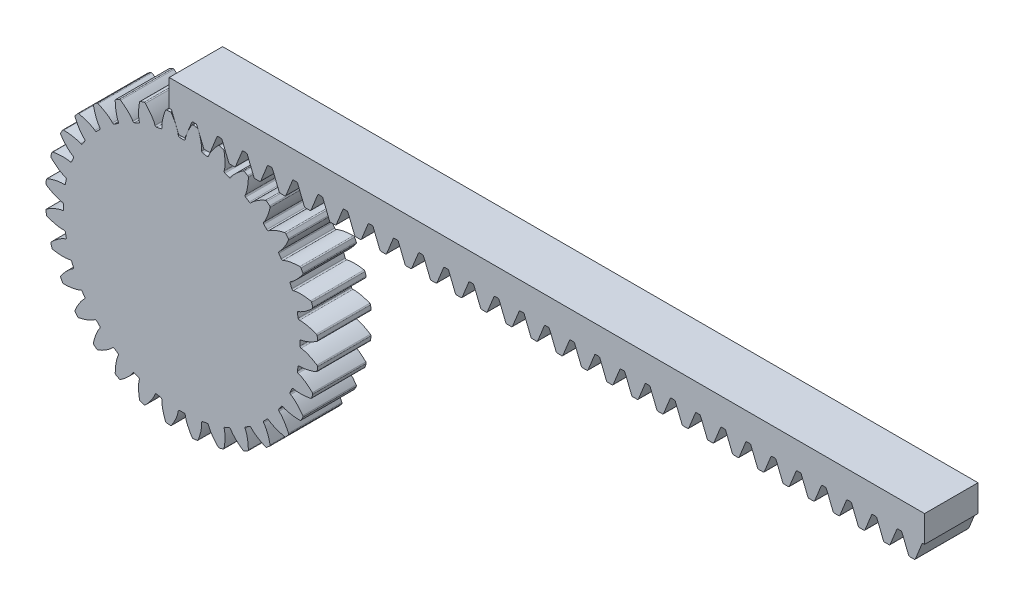
from build123d import *

# Parameters (mm, degrees)
SKETCH1_R                = 51
BOSS_EXTRUDE1_DEPTH      = 20
CUT_EXTRUDE3_DEPTH       = 75.846509605
FILLET1_R                = 0.5
CIRPATTERN1_COUNT        = 32
FILLET1_OF_CIRPATTERN1_R = 0.5
BOSS_EXTRUDE2_DEPTH      = 20
FILLET2_R                = 0.5
LPATTERN7_DEPTH          = 20


# Read off the part's stored shape, not the designer's step: LPattern7
with BuildPart() as part:
    # Sketch1 → Boss-Extrude1 (new body)
    with BuildSketch(Plane.XY):
        Circle(SKETCH1_R)
    extrude(amount=BOSS_EXTRUDE1_DEPTH)

    # Sketch3 → Cut-Extrude3 (cut, through all)
    with BuildSketch(Plane.XY):
        with BuildLine():
            add(Edge.make_bspline(
                [(1.29203821, 44.486066215), (1.302814451, 44.668832694), (1.366057296, 45.076437929), (1.534105828, 45.789290586), (1.827270897, 46.705234433), (2.128888857, 47.445621669), (2.32719165, 47.88141557), (2.355248368, 47.942181898)],
                knots=[0, 0, 0, 0, 0.040008387, 0.090017613, 0.160030412, 0.250046806, 0.264674884, 0.264674884, 0.264674884, 0.264674884], degree=3))
            add(Edge.make_bspline(
                [(2.355248368, 47.942181898), (2.787245487, 48.877818018), (3.339216628, 49.848020835), (3.952343038, 50.775687882), (3.997367676, 50.843102302)],
                knots=[0.264674884, 0.264674884, 0.264674884, 0.264674884, 0.489907489, 0.507621482, 0.507621482, 0.507621482, 0.507621482], degree=3))
            ThreePointArc((3.997367676, 50.843102302), (0, 51), (-3.997367676, 50.843102302))
            add(Edge.make_bspline(
                [(-2.355248368, 47.942181898), (-2.787245487, 48.877818018), (-3.339216628, 49.848020835), (-3.952343038, 50.775687882), (-3.997367676, 50.843102302)],
                knots=[0.264674884, 0.264674884, 0.264674884, 0.264674884, 0.489907489, 0.507621482, 0.507621482, 0.507621482, 0.507621482], degree=3))
            add(Edge.make_bspline(
                [(-1.29203821, 44.486066215), (-1.302814451, 44.668832694), (-1.366057296, 45.076437929), (-1.534105828, 45.789290586), (-1.827270897, 46.705234433), (-2.128888857, 47.445621669), (-2.32719165, 47.88141557), (-2.355248368, 47.942181898)],
                knots=[0, 0, 0, 0, 0.040008387, 0.090017613, 0.160030412, 0.250046806, 0.264674884, 0.264674884, 0.264674884, 0.264674884], degree=3))
            Line((-1.29203821, 44.486066215), (-1.284640278, 44.231348604))
            ThreePointArc((-1.284640278, 44.231348604), (0, 44.25), (1.284640278, 44.231348604))
            Line((1.284640278, 44.231348604), (1.29203821, 44.486066215))
        make_face()
    cut_extrude3 = extrude(amount=CUT_EXTRUDE3_DEPTH, mode=Mode.SUBTRACT)

    # Fillet1
    fillet1_edges = [part.edges().sort_by_distance(p)[0] for p in [
        (1.284640278, 44.231348604, 10),
        (-1.284640278, 44.231348604, 10),
        (3.997367676, 50.843102302, 10),
        (-3.997367676, 50.843102302, 10),
    ]]
    fillet(fillet1_edges, radius=FILLET1_R)

    # CirPattern1: Cut-Extrude3 ×32 about axis
    cirpattern1_axis = Axis((0, 0, 71.213492813), (0, 0, -1))
    for i in range(1, CIRPATTERN1_COUNT):
        add(cut_extrude3.rotate(cirpattern1_axis, i * 360 / CIRPATTERN1_COUNT), mode=Mode.SUBTRACT)

    # Fillet1 of CirPattern1
    fillet1_of_cirpattern1_edges = [part.edges().sort_by_distance(p)[0] for p in [
        (9.889064318, 43.130834758, 10),
        (7.369151767, 43.632076529, 10),
        (13.839556578, 49.0863186, 10),
        (5.998437823, 50.646014095, 10),
        (18.113457161, 40.37282712, 10),
        (15.739751443, 41.356048222, 10),
        (23.149899081, 45.443175203, 10),
        (15.763726721, 48.502627969, 10),
        (25.641760005, 36.063314377, 10),
        (23.505481297, 37.490730174, 10),
        (31.570603945, 40.053676068, 10),
        (24.923224441, 44.49531305, 10),
        (32.184664391, 30.367908687, 10),
        (30.367908687, 32.184664391, 10),
        (38.778068205, 33.124936623, 10),
        (33.124936623, 38.778068205, 10),
        (37.490730174, 23.505481297, 10),
        (36.063314377, 25.641760005, 10),
        (44.49531305, 24.923224441, 10),
        (40.053676068, 31.570603945, 10),
        (41.356048222, 15.739751443, 10),
        (40.37282712, 18.113457161, 10),
        (48.502627969, 15.763726721, 10),
        (45.443175203, 23.149899081, 10),
        (43.632076529, 7.369151767, 10),
        (43.130834758, 9.889064318, 10),
        (50.646014095, 5.998437823, 10),
        (49.0863186, 13.839556578, 10),
        (44.231348604, -1.284640278, 10),
        (44.231348604, 1.284640278, 10),
        (50.843102302, -3.997367676, 10),
        (50.843102302, 3.997367676, 10),
        (43.130834758, -9.889064318, 10),
        (43.632076529, -7.369151767, 10),
        (49.0863186, -13.839556578, 10),
        (50.646014095, -5.998437823, 10),
        (40.37282712, -18.113457161, 10),
        (41.356048222, -15.739751443, 10),
        (45.443175203, -23.149899081, 10),
        (48.502627969, -15.763726721, 10),
        (36.063314377, -25.641760005, 10),
        (37.490730174, -23.505481297, 10),
        (40.053676068, -31.570603945, 10),
        (44.49531305, -24.923224441, 10),
        (30.367908687, -32.184664391, 10),
        (32.184664391, -30.367908687, 10),
        (33.124936623, -38.778068205, 10),
        (38.778068205, -33.124936623, 10),
        (23.505481297, -37.490730174, 10),
        (25.641760005, -36.063314377, 10),
        (24.923224441, -44.49531305, 10),
        (31.570603945, -40.053676068, 10),
        (15.739751443, -41.356048222, 10),
        (18.113457161, -40.37282712, 10),
        (15.763726721, -48.502627969, 10),
        (23.149899081, -45.443175203, 10),
        (7.369151767, -43.632076529, 10),
        (9.889064318, -43.130834758, 10),
        (5.998437823, -50.646014095, 10),
        (13.839556578, -49.0863186, 10),
        (-1.284640278, -44.231348604, 10),
        (1.284640278, -44.231348604, 10),
        (-3.997367676, -50.843102302, 10),
        (3.997367676, -50.843102302, 10),
        (-9.889064318, -43.130834758, 10),
        (-7.369151767, -43.632076529, 10),
        (-13.839556578, -49.0863186, 10),
        (-5.998437823, -50.646014095, 10),
        (-18.113457161, -40.37282712, 10),
        (-15.739751443, -41.356048222, 10),
        (-23.149899081, -45.443175203, 10),
        (-15.763726721, -48.502627969, 10),
        (-25.641760005, -36.063314377, 10),
        (-23.505481297, -37.490730174, 10),
        (-31.570603945, -40.053676068, 10),
        (-24.923224441, -44.49531305, 10),
        (-32.184664391, -30.367908687, 10),
        (-30.367908687, -32.184664391, 10),
        (-38.778068205, -33.124936623, 10),
        (-33.124936623, -38.778068205, 10),
        (-37.490730174, -23.505481297, 10),
        (-36.063314377, -25.641760005, 10),
        (-44.49531305, -24.923224441, 10),
        (-40.053676068, -31.570603945, 10),
        (-41.356048222, -15.739751443, 10),
        (-40.37282712, -18.113457161, 10),
        (-48.502627969, -15.763726721, 10),
        (-45.443175203, -23.149899081, 10),
        (-43.632076529, -7.369151767, 10),
        (-43.130834758, -9.889064318, 10),
        (-50.646014095, -5.998437823, 10),
        (-49.0863186, -13.839556578, 10),
        (-44.231348604, 1.284640278, 10),
        (-44.231348604, -1.284640278, 10),
        (-50.843102302, 3.997367676, 10),
        (-50.843102302, -3.997367676, 10),
        (-43.130834758, 9.889064318, 10),
        (-43.632076529, 7.369151767, 10),
        (-49.0863186, 13.839556578, 10),
        (-50.646014095, 5.998437823, 10),
        (-40.37282712, 18.113457161, 10),
        (-41.356048222, 15.739751443, 10),
        (-45.443175203, 23.149899081, 10),
        (-48.502627969, 15.763726721, 10),
        (-36.063314377, 25.641760005, 10),
        (-37.490730174, 23.505481297, 10),
        (-40.053676068, 31.570603945, 10),
        (-44.49531305, 24.923224441, 10),
        (-30.367908687, 32.184664391, 10),
        (-32.184664391, 30.367908687, 10),
        (-33.124936623, 38.778068205, 10),
        (-38.778068205, 33.124936623, 10),
        (-23.505481297, 37.490730174, 10),
        (-25.641760005, 36.063314377, 10),
        (-24.923224441, 44.49531305, 10),
        (-31.570603945, 40.053676068, 10),
        (-15.739751443, 41.356048222, 10),
        (-18.113457161, 40.37282712, 10),
        (-15.763726721, 48.502627969, 10),
        (-23.149899081, 45.443175203, 10),
        (-7.369151767, 43.632076529, 10),
        (-9.889064318, 43.130834758, 10),
        (-5.998437823, 50.646014095, 10),
        (-13.839556578, 49.0863186, 10),
    ]]
    fillet(fillet1_of_cirpattern1_edges, radius=FILLET1_OF_CIRPATTERN1_R)


with BuildPart() as body_2:
    # Sketch4 → Boss-Extrude2 (new body)
    with BuildSketch(Plane.XY):
        Polygon((3.871445061, 51.75), (1.144268037, 45), (-1.144268037, 45), (-3.871445061, 51.75), (-4.71238898, 51.75), (-4.71238898, 61.75), (4.71238898, 61.75), (4.71238898, 51.75), align=None)
    extrude(amount=BOSS_EXTRUDE2_DEPTH)

    # Fillet2
    fillet2_edges = [body_2.edges().sort_by_distance(p)[0] for p in [
        (-1.144268037, 45, 10),
        (1.144268037, 45, 10),
        (3.871445061, 51.75, 10),
        (-3.871445061, 51.75, 10),
    ]]
    fillet(fillet2_edges, radius=FILLET2_R)

    # LPattern7 outline → LPattern7 (add)
    with BuildSketch(Plane.XY):
        with BuildLine():
            Line((4.71238898, 51.75), (5.216078641, 51.75))
            ThreePointArc((5.216078641, 51.75), (5.495675093, 51.664518786), (5.679670568, 51.437303297))
            Line((5.679670568, 51.437303297), (8.154172255, 45.312696703))
            ThreePointArc((8.154172255, 45.312696703), (8.338167731, 45.085481214), (8.617764182, 45))
            Line((8.617764182, 45), (10.231791739, 45))
            ThreePointArc((10.231791739, 45), (10.511388191, 45.085481214), (10.695383667, 45.312696703))
            Line((10.695383667, 45.312696703), (13.169885353, 51.437303297))
            ThreePointArc((13.169885353, 51.437303297), (13.353880829, 51.664518786), (13.633477281, 51.75))
            Line((13.633477281, 51.75), (14.640856602, 51.75))
            ThreePointArc((14.640856602, 51.75), (14.920453054, 51.664518786), (15.104448529, 51.437303297))
            Line((15.104448529, 51.437303297), (17.578950216, 45.312696703))
            ThreePointArc((17.578950216, 45.312696703), (17.762945691, 45.085481214), (18.042542143, 45))
            Line((18.042542143, 45), (19.6565697, 45))
            ThreePointArc((19.6565697, 45), (19.936166152, 45.085481214), (20.120161627, 45.312696703))
            Line((20.120161627, 45.312696703), (22.594663314, 51.437303297))
            ThreePointArc((22.594663314, 51.437303297), (22.77865879, 51.664518786), (23.058255241, 51.75))
            Line((23.058255241, 51.75), (24.065634563, 51.75))
            ThreePointArc((24.065634563, 51.75), (24.345231014, 51.664518786), (24.52922649, 51.437303297))
            Line((24.52922649, 51.437303297), (27.003728177, 45.312696703))
            ThreePointArc((27.003728177, 45.312696703), (27.187723652, 45.085481214), (27.467320104, 45))
            Line((27.467320104, 45), (29.081347661, 45))
            ThreePointArc((29.081347661, 45), (29.360944113, 45.085481214), (29.544939588, 45.312696703))
            Line((29.544939588, 45.312696703), (32.019441275, 51.437303297))
            ThreePointArc((32.019441275, 51.437303297), (32.20343675, 51.664518786), (32.483033202, 51.75))
            Line((32.483033202, 51.75), (33.490412523, 51.75))
            ThreePointArc((33.490412523, 51.75), (33.770008975, 51.664518786), (33.954004451, 51.437303297))
            Line((33.954004451, 51.437303297), (36.428506137, 45.312696703))
            ThreePointArc((36.428506137, 45.312696703), (36.612501613, 45.085481214), (36.892098065, 45))
            Line((36.892098065, 45), (38.506125622, 45))
            ThreePointArc((38.506125622, 45), (38.785722073, 45.085481214), (38.969717549, 45.312696703))
            Line((38.969717549, 45.312696703), (41.444219236, 51.437303297))
            ThreePointArc((41.444219236, 51.437303297), (41.628214711, 51.664518786), (41.907811163, 51.75))
            Line((41.907811163, 51.75), (42.915190484, 51.75))
            ThreePointArc((42.915190484, 51.75), (43.194786936, 51.664518786), (43.378782411, 51.437303297))
            Line((43.378782411, 51.437303297), (45.853284098, 45.312696703))
            ThreePointArc((45.853284098, 45.312696703), (46.037279574, 45.085481214), (46.316876025, 45))
            Line((46.316876025, 45), (47.930903582, 45))
            ThreePointArc((47.930903582, 45), (48.210500034, 45.085481214), (48.39449551, 45.312696703))
            Line((48.39449551, 45.312696703), (50.868997196, 51.437303297))
            ThreePointArc((50.868997196, 51.437303297), (51.052992672, 51.664518786), (51.332589124, 51.75))
            Line((51.332589124, 51.75), (52.339968445, 51.75))
            ThreePointArc((52.339968445, 51.75), (52.619564897, 51.664518786), (52.803560372, 51.437303297))
            Line((52.803560372, 51.437303297), (55.278062059, 45.312696703))
            ThreePointArc((55.278062059, 45.312696703), (55.462057534, 45.085481214), (55.741653986, 45))
            Line((55.741653986, 45), (57.355681543, 45))
            ThreePointArc((57.355681543, 45), (57.635277995, 45.085481214), (57.81927347, 45.312696703))
            Line((57.81927347, 45.312696703), (60.293775157, 51.437303297))
            ThreePointArc((60.293775157, 51.437303297), (60.477770633, 51.664518786), (60.757367084, 51.75))
            Line((60.757367084, 51.75), (61.764746406, 51.75))
            ThreePointArc((61.764746406, 51.75), (62.044342857, 51.664518786), (62.228338333, 51.437303297))
            Line((62.228338333, 51.437303297), (64.70284002, 45.312696703))
            ThreePointArc((64.70284002, 45.312696703), (64.886835495, 45.085481214), (65.166431947, 45))
            Line((65.166431947, 45), (66.780459504, 45))
            ThreePointArc((66.780459504, 45), (67.060055956, 45.085481214), (67.244051431, 45.312696703))
            Line((67.244051431, 45.312696703), (69.718553118, 51.437303297))
            ThreePointArc((69.718553118, 51.437303297), (69.902548593, 51.664518786), (70.182145045, 51.75))
            Line((70.182145045, 51.75), (71.189524366, 51.75))
            ThreePointArc((71.189524366, 51.75), (71.469120818, 51.664518786), (71.653116294, 51.437303297))
            Line((71.653116294, 51.437303297), (74.12761798, 45.312696703))
            ThreePointArc((74.12761798, 45.312696703), (74.311613456, 45.085481214), (74.591209908, 45))
            Line((74.591209908, 45), (76.205237465, 45))
            ThreePointArc((76.205237465, 45), (76.484833916, 45.085481214), (76.668829392, 45.312696703))
            Line((76.668829392, 45.312696703), (79.143331079, 51.437303297))
            ThreePointArc((79.143331079, 51.437303297), (79.327326554, 51.664518786), (79.606923006, 51.75))
            Line((79.606923006, 51.75), (80.614302327, 51.75))
            ThreePointArc((80.614302327, 51.75), (80.893898779, 51.664518786), (81.077894254, 51.437303297))
            Line((81.077894254, 51.437303297), (83.552395941, 45.312696703))
            ThreePointArc((83.552395941, 45.312696703), (83.736391417, 45.085481214), (84.015987868, 45))
            Line((84.015987868, 45), (85.630015425, 45))
            ThreePointArc((85.630015425, 45), (85.909611877, 45.085481214), (86.093607353, 45.312696703))
            Line((86.093607353, 45.312696703), (88.568109039, 51.437303297))
            ThreePointArc((88.568109039, 51.437303297), (88.752104515, 51.664518786), (89.031700967, 51.75))
            Line((89.031700967, 51.75), (90.039080288, 51.75))
            ThreePointArc((90.039080288, 51.75), (90.31867674, 51.664518786), (90.502672215, 51.437303297))
            Line((90.502672215, 51.437303297), (92.977173902, 45.312696703))
            ThreePointArc((92.977173902, 45.312696703), (93.161169377, 45.085481214), (93.440765829, 45))
            Line((93.440765829, 45), (95.054793386, 45))
            ThreePointArc((95.054793386, 45), (95.334389838, 45.085481214), (95.518385313, 45.312696703))
            Line((95.518385313, 45.312696703), (97.992887, 51.437303297))
            ThreePointArc((97.992887, 51.437303297), (98.176882476, 51.664518786), (98.456478927, 51.75))
            Line((98.456478927, 51.75), (99.463858249, 51.75))
            ThreePointArc((99.463858249, 51.75), (99.7434547, 51.664518786), (99.927450176, 51.437303297))
            Line((99.927450176, 51.437303297), (102.401951863, 45.312696703))
            ThreePointArc((102.401951863, 45.312696703), (102.585947338, 45.085481214), (102.86554379, 45))
            Line((102.86554379, 45), (104.479571347, 45))
            ThreePointArc((104.479571347, 45), (104.759167799, 45.085481214), (104.943163274, 45.312696703))
            Line((104.943163274, 45.312696703), (107.417664961, 51.437303297))
            ThreePointArc((107.417664961, 51.437303297), (107.601660436, 51.664518786), (107.881256888, 51.75))
            Line((107.881256888, 51.75), (108.888636209, 51.75))
            ThreePointArc((108.888636209, 51.75), (109.168232661, 51.664518786), (109.352228137, 51.437303297))
            Line((109.352228137, 51.437303297), (111.826729823, 45.312696703))
            ThreePointArc((111.826729823, 45.312696703), (112.010725299, 45.085481214), (112.290321751, 45))
            Line((112.290321751, 45), (113.904349308, 45))
            ThreePointArc((113.904349308, 45), (114.183945759, 45.085481214), (114.367941235, 45.312696703))
            Line((114.367941235, 45.312696703), (116.842442922, 51.437303297))
            ThreePointArc((116.842442922, 51.437303297), (117.026438397, 51.664518786), (117.306034849, 51.75))
            Line((117.306034849, 51.75), (118.31341417, 51.75))
            ThreePointArc((118.31341417, 51.75), (118.593010622, 51.664518786), (118.777006098, 51.437303297))
            Line((118.777006098, 51.437303297), (121.251507784, 45.312696703))
            ThreePointArc((121.251507784, 45.312696703), (121.43550326, 45.085481214), (121.715099711, 45))
            Line((121.715099711, 45), (123.329127269, 45))
            ThreePointArc((123.329127269, 45), (123.60872372, 45.085481214), (123.792719196, 45.312696703))
            Line((123.792719196, 45.312696703), (126.267220882, 51.437303297))
            ThreePointArc((126.267220882, 51.437303297), (126.451216358, 51.664518786), (126.73081281, 51.75))
            Line((126.73081281, 51.75), (127.738192131, 51.75))
            ThreePointArc((127.738192131, 51.75), (128.017788583, 51.664518786), (128.201784058, 51.437303297))
            Line((128.201784058, 51.437303297), (130.676285745, 45.312696703))
            ThreePointArc((130.676285745, 45.312696703), (130.860281221, 45.085481214), (131.139877672, 45))
            Line((131.139877672, 45), (132.753905229, 45))
            ThreePointArc((132.753905229, 45), (133.033501681, 45.085481214), (133.217497157, 45.312696703))
            Line((133.217497157, 45.312696703), (135.691998843, 51.437303297))
            ThreePointArc((135.691998843, 51.437303297), (135.875994319, 51.664518786), (136.155590771, 51.75))
            Line((136.155590771, 51.75), (137.162970092, 51.75))
            ThreePointArc((137.162970092, 51.75), (137.442566544, 51.664518786), (137.626562019, 51.437303297))
            Line((137.626562019, 51.437303297), (140.101063706, 45.312696703))
            ThreePointArc((140.101063706, 45.312696703), (140.285059181, 45.085481214), (140.564655633, 45))
            Line((140.564655633, 45), (142.17868319, 45))
            ThreePointArc((142.17868319, 45), (142.458279642, 45.085481214), (142.642275117, 45.312696703))
            Line((142.642275117, 45.312696703), (145.116776804, 51.437303297))
            ThreePointArc((145.116776804, 51.437303297), (145.30077228, 51.664518786), (145.580368731, 51.75))
            Line((145.580368731, 51.75), (146.587748053, 51.75))
            ThreePointArc((146.587748053, 51.75), (146.867344504, 51.664518786), (147.05133998, 51.437303297))
            Line((147.05133998, 51.437303297), (149.525841667, 45.312696703))
            ThreePointArc((149.525841667, 45.312696703), (149.709837142, 45.085481214), (149.989433594, 45))
            Line((149.989433594, 45), (151.603461151, 45))
            ThreePointArc((151.603461151, 45), (151.883057603, 45.085481214), (152.067053078, 45.312696703))
            Line((152.067053078, 45.312696703), (154.541554765, 51.437303297))
            ThreePointArc((154.541554765, 51.437303297), (154.72555024, 51.664518786), (155.005146692, 51.75))
            Line((155.005146692, 51.75), (156.012526013, 51.75))
            ThreePointArc((156.012526013, 51.75), (156.292122465, 51.664518786), (156.476117941, 51.437303297))
            Line((156.476117941, 51.437303297), (158.950619627, 45.312696703))
            ThreePointArc((158.950619627, 45.312696703), (159.134615103, 45.085481214), (159.414211555, 45))
            Line((159.414211555, 45), (161.028239112, 45))
            ThreePointArc((161.028239112, 45), (161.307835563, 45.085481214), (161.491831039, 45.312696703))
            Line((161.491831039, 45.312696703), (163.966332726, 51.437303297))
            ThreePointArc((163.966332726, 51.437303297), (164.150328201, 51.664518786), (164.429924653, 51.75))
            Line((164.429924653, 51.75), (165.437303974, 51.75))
            ThreePointArc((165.437303974, 51.75), (165.716900426, 51.664518786), (165.900895901, 51.437303297))
            Line((165.900895901, 51.437303297), (168.375397588, 45.312696703))
            ThreePointArc((168.375397588, 45.312696703), (168.559393064, 45.085481214), (168.838989515, 45))
            Line((168.838989515, 45), (170.453017072, 45))
            ThreePointArc((170.453017072, 45), (170.732613524, 45.085481214), (170.916609, 45.312696703))
            Line((170.916609, 45.312696703), (173.391110686, 51.437303297))
            ThreePointArc((173.391110686, 51.437303297), (173.575106162, 51.664518786), (173.854702614, 51.75))
            Line((173.854702614, 51.75), (174.862081935, 51.75))
            ThreePointArc((174.862081935, 51.75), (175.141678387, 51.664518786), (175.325673862, 51.437303297))
            Line((175.325673862, 51.437303297), (177.800175549, 45.312696703))
            ThreePointArc((177.800175549, 45.312696703), (177.984171024, 45.085481214), (178.263767476, 45))
            Line((178.263767476, 45), (179.877795033, 45))
            ThreePointArc((179.877795033, 45), (180.157391485, 45.085481214), (180.34138696, 45.312696703))
            Line((180.34138696, 45.312696703), (182.815888647, 51.437303297))
            ThreePointArc((182.815888647, 51.437303297), (182.999884123, 51.664518786), (183.279480574, 51.75))
            Line((183.279480574, 51.75), (184.286859896, 51.75))
            ThreePointArc((184.286859896, 51.75), (184.566456347, 51.664518786), (184.750451823, 51.437303297))
            Line((184.750451823, 51.437303297), (187.22495351, 45.312696703))
            ThreePointArc((187.22495351, 45.312696703), (187.408948985, 45.085481214), (187.688545437, 45))
            Line((187.688545437, 45), (189.302572994, 45))
            ThreePointArc((189.302572994, 45), (189.582169446, 45.085481214), (189.766164921, 45.312696703))
            Line((189.766164921, 45.312696703), (192.240666608, 51.437303297))
            ThreePointArc((192.240666608, 51.437303297), (192.424662083, 51.664518786), (192.704258535, 51.75))
            Line((192.704258535, 51.75), (193.711637856, 51.75))
            ThreePointArc((193.711637856, 51.75), (193.991234308, 51.664518786), (194.175229784, 51.437303297))
            Line((194.175229784, 51.437303297), (196.64973147, 45.312696703))
            ThreePointArc((196.64973147, 45.312696703), (196.833726946, 45.085481214), (197.113323398, 45))
            Line((197.113323398, 45), (198.727350955, 45))
            ThreePointArc((198.727350955, 45), (199.006947406, 45.085481214), (199.190942882, 45.312696703))
            Line((199.190942882, 45.312696703), (201.665444569, 51.437303297))
            ThreePointArc((201.665444569, 51.437303297), (201.849440044, 51.664518786), (202.129036496, 51.75))
            Line((202.129036496, 51.75), (203.136415817, 51.75))
            ThreePointArc((203.136415817, 51.75), (203.416012269, 51.664518786), (203.600007744, 51.437303297))
            Line((203.600007744, 51.437303297), (206.074509431, 45.312696703))
            ThreePointArc((206.074509431, 45.312696703), (206.258504907, 45.085481214), (206.538101358, 45))
            Line((206.538101358, 45), (208.152128915, 45))
            ThreePointArc((208.152128915, 45), (208.431725367, 45.085481214), (208.615720843, 45.312696703))
            Line((208.615720843, 45.312696703), (211.090222529, 51.437303297))
            ThreePointArc((211.090222529, 51.437303297), (211.274218005, 51.664518786), (211.553814457, 51.75))
            Line((211.553814457, 51.75), (212.561193778, 51.75))
            ThreePointArc((212.561193778, 51.75), (212.84079023, 51.664518786), (213.024785705, 51.437303297))
            Line((213.024785705, 51.437303297), (215.499287392, 45.312696703))
            ThreePointArc((215.499287392, 45.312696703), (215.683282867, 45.085481214), (215.962879319, 45))
            Line((215.962879319, 45), (217.576906876, 45))
            ThreePointArc((217.576906876, 45), (217.856503328, 45.085481214), (218.040498803, 45.312696703))
            Line((218.040498803, 45.312696703), (220.51500049, 51.437303297))
            ThreePointArc((220.51500049, 51.437303297), (220.698995966, 51.664518786), (220.978592417, 51.75))
            Line((220.978592417, 51.75), (221.985971739, 51.75))
            ThreePointArc((221.985971739, 51.75), (222.26556819, 51.664518786), (222.449563666, 51.437303297))
            Line((222.449563666, 51.437303297), (224.924065353, 45.312696703))
            ThreePointArc((224.924065353, 45.312696703), (225.108060828, 45.085481214), (225.38765728, 45))
            Line((225.38765728, 45), (227.001684837, 45))
            ThreePointArc((227.001684837, 45), (227.281281289, 45.085481214), (227.465276764, 45.312696703))
            Line((227.465276764, 45.312696703), (229.939778451, 51.437303297))
            ThreePointArc((229.939778451, 51.437303297), (230.123773926, 51.664518786), (230.403370378, 51.75))
            Line((230.403370378, 51.75), (231.410749699, 51.75))
            ThreePointArc((231.410749699, 51.75), (231.690346151, 51.664518786), (231.874341627, 51.437303297))
            Line((231.874341627, 51.437303297), (234.348843313, 45.312696703))
            ThreePointArc((234.348843313, 45.312696703), (234.532838789, 45.085481214), (234.812435241, 45))
            Line((234.812435241, 45), (236.426462798, 45))
            ThreePointArc((236.426462798, 45), (236.706059249, 45.085481214), (236.890054725, 45.312696703))
            Line((236.890054725, 45.312696703), (239.364556412, 51.437303297))
            ThreePointArc((239.364556412, 51.437303297), (239.548551887, 51.664518786), (239.828148339, 51.75))
            Line((239.828148339, 51.75), (240.83552766, 51.75))
            ThreePointArc((240.83552766, 51.75), (241.115124112, 51.664518786), (241.299119588, 51.437303297))
            Line((241.299119588, 51.437303297), (243.773621274, 45.312696703))
            ThreePointArc((243.773621274, 45.312696703), (243.95761675, 45.085481214), (244.237213201, 45))
            Line((244.237213201, 45), (245.851240758, 45))
            ThreePointArc((245.851240758, 45), (246.13083721, 45.085481214), (246.314832686, 45.312696703))
            Line((246.314832686, 45.312696703), (248.789334372, 51.437303297))
            ThreePointArc((248.789334372, 51.437303297), (248.973329848, 51.664518786), (249.2529263, 51.75))
            Line((249.2529263, 51.75), (250.260305621, 51.75))
            ThreePointArc((250.260305621, 51.75), (250.539902073, 51.664518786), (250.723897548, 51.437303297))
            Line((250.723897548, 51.437303297), (253.198399235, 45.312696703))
            ThreePointArc((253.198399235, 45.312696703), (253.382394711, 45.085481214), (253.661991162, 45))
            Line((253.661991162, 45), (255.276018719, 45))
            ThreePointArc((255.276018719, 45), (255.555615171, 45.085481214), (255.739610647, 45.312696703))
            Line((255.739610647, 45.312696703), (258.214112333, 51.437303297))
            ThreePointArc((258.214112333, 51.437303297), (258.398107809, 51.664518786), (258.67770426, 51.75))
            Line((258.67770426, 51.75), (259.685083582, 51.75))
            ThreePointArc((259.685083582, 51.75), (259.964680034, 51.664518786), (260.148675509, 51.437303297))
            Line((260.148675509, 51.437303297), (262.623177196, 45.312696703))
            ThreePointArc((262.623177196, 45.312696703), (262.807172671, 45.085481214), (263.086769123, 45))
            Line((263.086769123, 45), (264.70079668, 45))
            ThreePointArc((264.70079668, 45), (264.980393132, 45.085481214), (265.164388607, 45.312696703))
            Line((265.164388607, 45.312696703), (267.638890294, 51.437303297))
            ThreePointArc((267.638890294, 51.437303297), (267.82288577, 51.664518786), (268.102482221, 51.75))
            Line((268.102482221, 51.75), (269.109861543, 51.75))
            ThreePointArc((269.109861543, 51.75), (269.389457994, 51.664518786), (269.57345347, 51.437303297))
            Line((269.57345347, 51.437303297), (272.047955157, 45.312696703))
            ThreePointArc((272.047955157, 45.312696703), (272.231950632, 45.085481214), (272.511547084, 45))
            Line((272.511547084, 45), (274.125574641, 45))
            ThreePointArc((274.125574641, 45), (274.405171093, 45.085481214), (274.589166568, 45.312696703))
            Line((274.589166568, 45.312696703), (277.063668255, 51.437303297))
            ThreePointArc((277.063668255, 51.437303297), (277.24766373, 51.664518786), (277.527260182, 51.75))
            Line((277.527260182, 51.75), (278.030949843, 51.75))
            Line((278.030949843, 51.75), (278.030949843, 61.75))
            Line((278.030949843, 61.75), (4.71238898, 61.75))
            Line((4.71238898, 61.75), (4.71238898, 51.75))
        make_face()
    extrude(amount=LPATTERN7_DEPTH)


solid = Compound([part.part, body_2.part])
